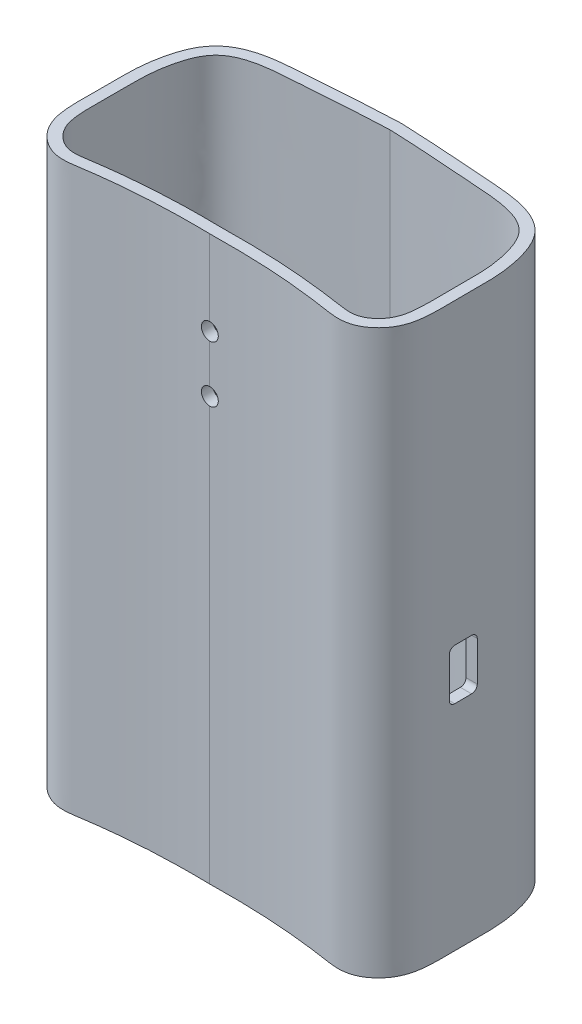
from build123d import *

# Parameters (mm, degrees)
Y_KSEKLIK_EKSTR_ZYON1_DEPTH = 100
IZIM3_R                     = 1.5
KES_EKSTR_ZYON1_DEPTH       = 10
Y_KSEKLIK_EKSTR_ZYON2_DEPTH = 4
KES_EKSTR_ZYON2_DEPTH       = 44


with BuildPart() as part:
    # Çizim1 → Yükseklik-Ekstrüzyon1 (new body)
    with BuildSketch(Plane(origin=(0, 0, 0), x_dir=(1, 0, 0), z_dir=(0, 1, 0))):
        with BuildLine():
            add(Edge.make_bspline(
                [(0, 19.93026058), (-0.456912568, 19.913044156), (-1.378839943, 19.876102375), (-3.156788416, 19.794351658), (-5.316920069, 19.678016457), (-7.841775812, 19.519464651), (-11.189989105, 19.289535487), (-14.591856328, 19.030001897), (-18.287199098, 18.784185441), (-21.261903526, 18.486143303), (-24.224686789, 17.856341815), (-26.580303347, 16.823221448), (-28.255147115, 15.518782085), (-29.688879781, 13.830583224), (-30.777655499, 11.429600247), (-31.51434839, 8.588281022), (-31.923221921, 5.825022746), (-32.0440681, 3.056583967), (-31.987890956, 0.428578042), (-32.01708483, -2.068301489), (-32.051981724, -4.710614271), (-32.003565709, -7.406147252), (-31.648596651, -10.011539852), (-30.627497359, -12.156132439), (-29.506723331, -13.557042968), (-28.106496306, -14.69864579), (-26.704959708, -15.36667834), (-25.45815578, -15.635885952), (-24.289493621, -15.718491881), (-22.955316386, -15.603236807), (-21.618498846, -15.384071712), (-20.348009107, -15.200505648), (-19.074667671, -15.027357671), (-17.394234251, -14.818668954), (-15.310241024, -14.594364683), (-12.822903196, -14.381928941), (-9.502603912, -14.169892052), (-6.138514535, -14.059211791), (-2.68485003, -14.038099162), (-0.889123923, -14.056381118), (0, -14.071445744)],
                knots=[-0.000855941, -0.000855941, -0.000855941, -0.000855941, 0.014788494, 0.030432928, 0.061721797, 0.093010666, 0.124299534, 0.186877272, 0.218166141, 0.249455009, 0.280743878, 0.312032747, 0.327677181, 0.343321616, 0.374610484, 0.405899353, 0.437188222, 0.46847709, 0.499765959, 0.531054828, 0.562343697, 0.593632565, 0.624921434, 0.640565869, 0.656210303, 0.671854737, 0.687499172, 0.695321389, 0.703143606, 0.71878804, 0.734432475, 0.750076909, 0.765721343, 0.781365778, 0.812654647, 0.843943515, 0.875232384, 0.937810121, 0.96909899, 1.000387859, 1.000387859, 1.000387859, 1.000387859], degree=3))
            add(Edge.make_bspline(
                [(0, -14.071445744), (0.889123923, -14.056381118), (2.68485003, -14.038099162), (6.138514535, -14.059211791), (9.502603912, -14.169892052), (12.822903196, -14.381928941), (15.310241024, -14.594364683), (17.394234251, -14.818668954), (19.074667671, -15.027357671), (20.348009107, -15.200505648), (21.618498846, -15.384071712), (22.955316386, -15.603236807), (24.289493621, -15.718491881), (25.45815578, -15.635885952), (26.704959708, -15.36667834), (28.106496306, -14.69864579), (29.506723331, -13.557042968), (30.627497359, -12.156132439), (31.648596651, -10.011539852), (32.003565709, -7.406147252), (32.051981724, -4.710614271), (32.01708483, -2.068301489), (31.987890956, 0.428578042), (32.0440681, 3.056583967), (31.923221921, 5.825022746), (31.51434839, 8.588281022), (30.777655499, 11.429600247), (29.688879781, 13.830583224), (28.255147115, 15.518782085), (26.580303347, 16.823221448), (24.224686789, 17.856341815), (21.261903526, 18.486143303), (18.287199098, 18.784185441), (14.591856328, 19.030001897), (11.189989105, 19.289535487), (7.841775812, 19.519464651), (5.316920069, 19.678016457), (3.156788416, 19.794351658), (1.378839943, 19.876102375), (0.456912568, 19.913044156), (0, 19.93026058)],
                knots=[-0.000855941, -0.000855941, -0.000855941, -0.000855941, 0.030432928, 0.061721797, 0.124299534, 0.155588403, 0.186877272, 0.218166141, 0.233810575, 0.249455009, 0.265099444, 0.280743878, 0.296388312, 0.30421053, 0.312032747, 0.327677181, 0.343321616, 0.35896605, 0.374610484, 0.405899353, 0.437188222, 0.46847709, 0.499765959, 0.531054828, 0.562343697, 0.593632565, 0.624921434, 0.656210303, 0.671854737, 0.687499172, 0.71878804, 0.750076909, 0.781365778, 0.812654647, 0.875232384, 0.906521253, 0.937810121, 0.96909899, 0.984743425, 1.000387859, 1.000387859, 1.000387859, 1.000387859], degree=3))
        make_face()
        with BuildLine():
            add(Edge.make_bspline(
                [(0, 17.928841308), (-5.820212095, 17.709536244), (-13.903357487, 17.042587637), (-26.87571665, 16.196014495), (-29.550286899, 8.929250371), (-30.090469717, 4.336098712), (-29.940693307, -0.887353996), (-30.154927851, -5.701691423), (-29.637182829, -10.928766593), (-26.031174583, -14.081750554), (-15.720131404, -12.349312728), (-7.807226576, -11.938879102), (0, -12.071158692)],
                knots=[0, 0, 0, 0, 0.198459501, 0.336012796, 0.394476639, 0.459729731, 0.505376957, 0.582750838, 0.635932872, 0.690008906, 0.731880659, 1, 1, 1, 1], degree=3))
            add(Edge.make_bspline(
                [(0, 17.928841308), (5.820212095, 17.709536244), (13.903357487, 17.042587637), (26.87571665, 16.196014495), (29.550286899, 8.929250371), (30.090469717, 4.336098712), (29.940693307, -0.887353996), (30.154927851, -5.701691423), (29.637182829, -10.928766593), (26.031174583, -14.081750554), (15.720131404, -12.349312728), (7.807226576, -11.938879102), (0, -12.071158692)],
                knots=[0, 0, 0, 0, 0.198459501, 0.336012796, 0.394476639, 0.459729731, 0.505376957, 0.582750838, 0.635932872, 0.690008906, 0.731880659, 1, 1, 1, 1], degree=3))
        make_face(mode=Mode.SUBTRACT)
    extrude(amount=Y_KSEKLIK_EKSTR_ZYON1_DEPTH)

    # Çizim3 → Kes-Ekstrüzyon1 (cut)
    with BuildSketch(Plane(origin=(0, 0, 14.071445744), x_dir=(-1, 0, 0), z_dir=(0, 0, -1))):
        with Locations((0, 85)):
            Circle(IZIM3_R)
        with Locations((0, 75)):
            Circle(IZIM3_R)
    extrude(amount=KES_EKSTR_ZYON1_DEPTH, mode=Mode.SUBTRACT)

    # Çizim4 → Yükseklik-Ekstrüzyon2 (add)
    with BuildSketch(Plane.XZ):
        with BuildLine():
            add(Edge.make_bspline(
                [(0, -19.93026058), (0.456912568, -19.913044156), (1.378839943, -19.876102375), (3.156788416, -19.794351658), (5.316920069, -19.678016457), (7.841775812, -19.519464651), (11.189989105, -19.289535487), (14.591856328, -19.030001897), (18.287199098, -18.784185441), (21.261903526, -18.486143303), (24.224686789, -17.856341815), (26.580303347, -16.823221448), (28.255147115, -15.518782085), (29.688879781, -13.830583224), (30.777655499, -11.429600247), (31.51434839, -8.588281022), (31.923221921, -5.825022746), (32.0440681, -3.056583967), (31.987890956, -0.428578042), (32.01708483, 2.068301489), (32.051981724, 4.710614271), (32.003565709, 7.406147252), (31.648596651, 10.011539852), (30.627497359, 12.156132439), (29.506723331, 13.557042968), (28.106496306, 14.69864579), (26.704959708, 15.36667834), (25.45815578, 15.635885952), (24.289493621, 15.718491881), (22.955316386, 15.603236807), (21.618498846, 15.384071712), (20.348009107, 15.200505648), (19.074667671, 15.027357671), (17.394234251, 14.818668954), (15.310241024, 14.594364683), (12.822903196, 14.381928941), (9.502603912, 14.169892052), (6.138514535, 14.059211791), (2.68485003, 14.038099162), (0.889123923, 14.056381118), (0, 14.071445744)],
                knots=[-0.000855941, -0.000855941, -0.000855941, -0.000855941, 0.014788494, 0.030432928, 0.061721797, 0.093010666, 0.124299534, 0.186877272, 0.218166141, 0.249455009, 0.280743878, 0.312032747, 0.327677181, 0.343321616, 0.374610484, 0.405899353, 0.437188222, 0.46847709, 0.499765959, 0.531054828, 0.562343697, 0.593632565, 0.624921434, 0.640565869, 0.656210303, 0.671854737, 0.687499172, 0.695321389, 0.703143606, 0.71878804, 0.734432475, 0.750076909, 0.765721343, 0.781365778, 0.812654647, 0.843943515, 0.875232384, 0.937810121, 0.96909899, 1.000387859, 1.000387859, 1.000387859, 1.000387859], degree=3))
            add(Edge.make_bspline(
                [(0, 14.071445744), (-0.889123923, 14.056381118), (-2.68485003, 14.038099162), (-6.138514535, 14.059211791), (-9.502603912, 14.169892052), (-12.822903196, 14.381928941), (-15.310241024, 14.594364683), (-17.394234251, 14.818668954), (-19.074667671, 15.027357671), (-20.348009107, 15.200505648), (-21.618498846, 15.384071712), (-22.955316386, 15.603236807), (-24.289493621, 15.718491881), (-25.45815578, 15.635885952), (-26.704959708, 15.36667834), (-28.106496306, 14.69864579), (-29.506723331, 13.557042968), (-30.627497359, 12.156132439), (-31.648596651, 10.011539852), (-32.003565709, 7.406147252), (-32.051981724, 4.710614271), (-32.01708483, 2.068301489), (-31.987890956, -0.428578042), (-32.0440681, -3.056583967), (-31.923221921, -5.825022746), (-31.51434839, -8.588281022), (-30.777655499, -11.429600247), (-29.688879781, -13.830583224), (-28.255147115, -15.518782085), (-26.580303347, -16.823221448), (-24.224686789, -17.856341815), (-21.261903526, -18.486143303), (-18.287199098, -18.784185441), (-14.591856328, -19.030001897), (-11.189989105, -19.289535487), (-7.841775812, -19.519464651), (-5.316920069, -19.678016457), (-3.156788416, -19.794351658), (-1.378839943, -19.876102375), (-0.456912568, -19.913044156), (0, -19.93026058)],
                knots=[-0.000855941, -0.000855941, -0.000855941, -0.000855941, 0.030432928, 0.061721797, 0.124299534, 0.155588403, 0.186877272, 0.218166141, 0.233810575, 0.249455009, 0.265099444, 0.280743878, 0.296388312, 0.30421053, 0.312032747, 0.327677181, 0.343321616, 0.35896605, 0.374610484, 0.405899353, 0.437188222, 0.46847709, 0.499765959, 0.531054828, 0.562343697, 0.593632565, 0.624921434, 0.656210303, 0.671854737, 0.687499172, 0.71878804, 0.750076909, 0.781365778, 0.812654647, 0.875232384, 0.906521253, 0.937810121, 0.96909899, 0.984743425, 1.000387859, 1.000387859, 1.000387859, 1.000387859], degree=3))
        make_face()
    extrude(amount=-Y_KSEKLIK_EKSTR_ZYON2_DEPTH)

    # Çizim6 → Kes-Ekstrüzyon2 (cut)
    with BuildSketch(Plane(origin=(0, 0, 0), x_dir=(0, 0, -1), z_dir=(-1, 0, 0))):
        with BuildLine():
            Line((-2.571445744, -47), (0.428554256, -47))
            ThreePointArc((0.428554256, -47), (1.135661037, -46.707106781), (1.428554256, -46))
            Line((1.428554256, -46), (1.428554256, -39))
            ThreePointArc((1.428554256, -39), (1.135661037, -38.292893219), (0.428554256, -38))
            Line((0.428554256, -38), (-2.571445744, -38))
            ThreePointArc((-2.571445744, -38), (-3.278552525, -38.292893219), (-3.571445744, -39))
            Line((-3.571445744, -39), (-3.571445744, -46))
            ThreePointArc((-3.571445744, -46), (-3.278552525, -46.707106781), (-2.571445744, -47))
        make_face()
    extrude(amount=-KES_EKSTR_ZYON2_DEPTH, mode=Mode.SUBTRACT)


solid = part.part
